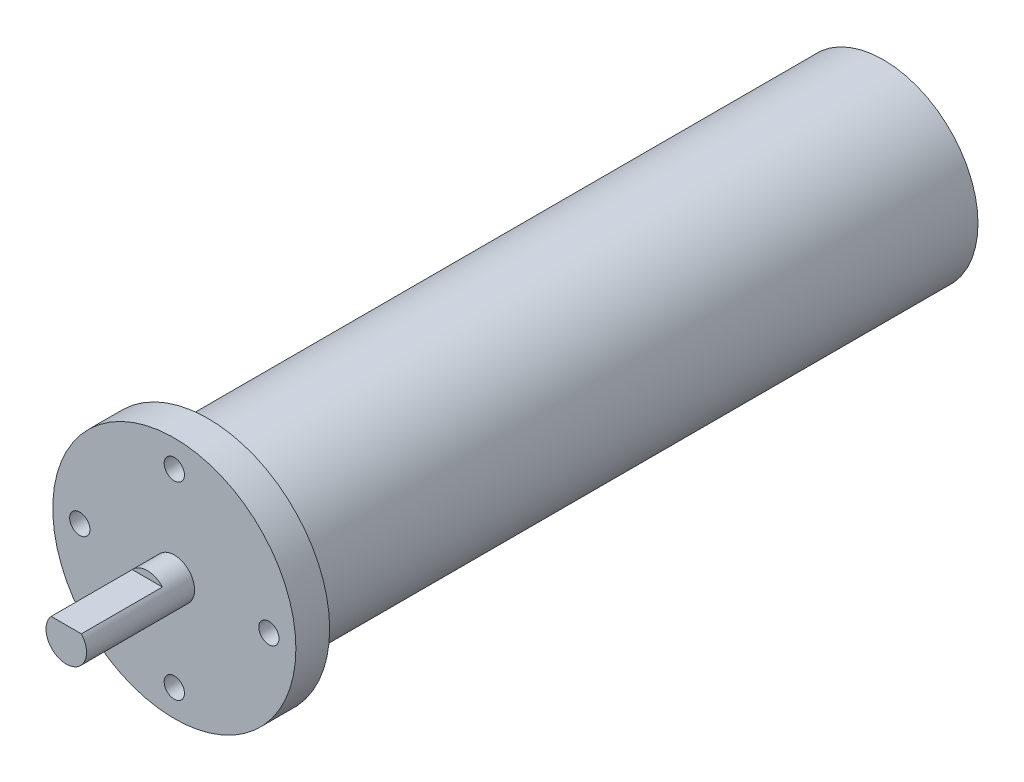
from build123d import *

# Parameters (mm, degrees)
SKETCH1_R           = 14
BOSS_EXTRUDE3_DEPTH = 100
SKETCH4_R           = 18
BOSS_EXTRUDE4_DEPTH = 5
SKETCH5_R           = 1.5
CUT_EXTRUDE2_DEPTH  = 4
SKETCH7_R           = 3
BOSS_EXTRUDE7_DEPTH = 16
SKETCH8_W           = 15.782002666
SKETCH8_H           = 7.151039119
CUT_EXTRUDE3_DEPTH  = 8


with BuildPart() as part:
    # Sketch1 → Boss-Extrude3 (new body)
    with BuildSketch(Plane.XY):
        Circle(SKETCH1_R)
    extrude(amount=BOSS_EXTRUDE3_DEPTH)

    # Sketch4 → Boss-Extrude4 (add)
    with BuildSketch(Plane.XY.offset(100)):
        Circle(SKETCH4_R)
    extrude(amount=BOSS_EXTRUDE4_DEPTH)

    # Sketch5 → Cut-Extrude2 (cut)
    with BuildSketch(Plane.XY.offset(105)):
        with Locations((0, 14)):
            Circle(SKETCH5_R)
        with Locations((14, 0)):
            Circle(SKETCH5_R)
        with Locations((0, -14)):
            Circle(SKETCH5_R)
        with Locations((-14, 0)):
            Circle(SKETCH5_R)
    extrude(amount=-CUT_EXTRUDE2_DEPTH, mode=Mode.SUBTRACT)

    # Sketch7 → Boss-Extrude7 (add)
    with BuildSketch(Plane.XY.offset(105)):
        Circle(SKETCH7_R)
    extrude(amount=BOSS_EXTRUDE7_DEPTH)

    # Sketch8 → Cut-Extrude3 (cut, symmetric)
    with BuildSketch(Plane(origin=(0, 0, 0), x_dir=(0, 0, -1), z_dir=(1, 0, 0))):
        with Locations((-116.891001333, 5.575519559)):
            Rectangle(SKETCH8_W, SKETCH8_H)
    extrude(amount=CUT_EXTRUDE3_DEPTH, both=True, mode=Mode.SUBTRACT)


solid = part.part
